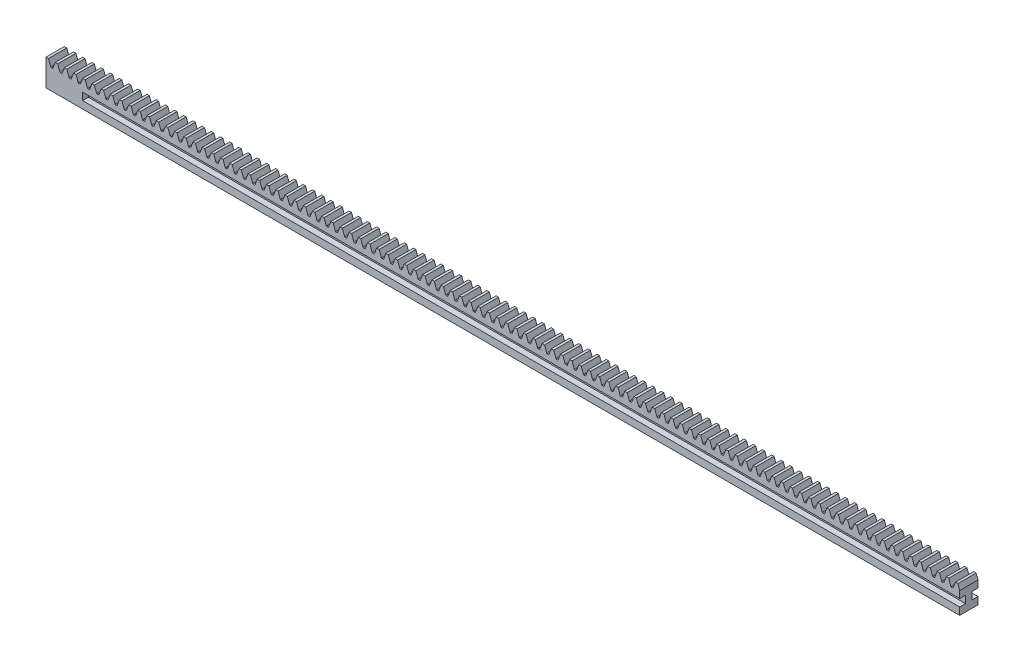
from build123d import *

# Parameters (mm, degrees)
BOSS_EXTRUDE1_DEPTH      = 125
BOSS_EXTRUDE1_DEPTH_BACK = 125
SKETCH3_W                = 5
SKETCH3_H                = 7.3
CUT_EXTRUDE1_DEPTH       = 126.078265498
FILLET1_R                = 0.167343945
LPATTERN1_START          = -2.5
LPATTERN1_DEPTH          = 5
SKETCH7_W                = 1.5875
SKETCH7_H                = 2
CUT_EXTRUDE2_DEPTH       = 240


# Read off the part's stored shape, not the designer's step: LPattern1
with BuildPart() as part:
    # Sketch3 → Boss-Extrude1 (new, two sides: drawn at the far end of the back side and taken through both)
    with BuildSketch(Plane(origin=(0, 0, 0), x_dir=(0, 0, -1), z_dir=(1, 0, 0)).offset(-BOSS_EXTRUDE1_DEPTH_BACK)):
        Rectangle(SKETCH3_W, SKETCH3_H)
    extrude(amount=BOSS_EXTRUDE1_DEPTH + BOSS_EXTRUDE1_DEPTH_BACK)

    # Sketch4 → Cut-Extrude1 (cut, symmetric)
    with BuildSketch(Plane.XY):
        Polygon((-124.325716375, 3.65), (-123.685128763, 1.89), (-123.127315612, 1.89), (-122.486728, 3.65), align=None)
    extrude(amount=CUT_EXTRUDE1_DEPTH, both=True, mode=Mode.SUBTRACT)

    # Fillet1
    fillet1_edges = [part.edges().sort_by_distance(p)[0] for p in [
        (-123.127315612, 1.89, 0),
        (-123.685128763, 1.89, 0),
    ]]
    fillet(fillet1_edges, radius=FILLET1_R)

    # LPattern1 outline → LPattern1 (cut)
    with BuildSketch(Plane.XY.offset(LPATTERN1_START)):
        with BuildLine():
            ThreePointArc((-121.211933141, 2.000108945), (-121.150665815, 1.92026381), (-121.054681271, 1.89))
            Line((-121.054681271, 1.89), (-120.731219104, 1.89))
            ThreePointArc((-120.731219104, 1.89), (-120.63523456, 1.92026381), (-120.573967234, 2.000108945))
            Line((-120.573967234, 2.000108945), (-119.973456, 3.65))
            Line((-119.973456, 3.65), (-121.812444375, 3.65))
            Line((-121.812444375, 3.65), (-121.211933141, 2.000108945))
        make_face()
        Polygon((125, 3.65), (124.488211625, 3.65), (125, 2.243872997), align=None)
        with BuildLine():
            Line((123.813928, 3.65), (121.974939625, 3.65))
            Line((121.974939625, 3.65), (122.575450859, 2.000108945))
            ThreePointArc((122.575450859, 2.000108945), (122.636718185, 1.92026381), (122.732702729, 1.89))
            Line((122.732702729, 1.89), (123.056164896, 1.89))
            ThreePointArc((123.056164896, 1.89), (123.15214944, 1.92026381), (123.213416766, 2.000108945))
            Line((123.213416766, 2.000108945), (123.813928, 3.65))
        make_face()
        with BuildLine():
            Line((121.300656, 3.65), (119.461667625, 3.65))
            Line((119.461667625, 3.65), (120.062178859, 2.000108945))
            ThreePointArc((120.062178859, 2.000108945), (120.123446185, 1.92026381), (120.219430729, 1.89))
            Line((120.219430729, 1.89), (120.542892896, 1.89))
            ThreePointArc((120.542892896, 1.89), (120.63887744, 1.92026381), (120.700144766, 2.000108945))
            Line((120.700144766, 2.000108945), (121.300656, 3.65))
        make_face()
        with BuildLine():
            Line((118.787384, 3.65), (116.948395625, 3.65))
            Line((116.948395625, 3.65), (117.548906859, 2.000108945))
            ThreePointArc((117.548906859, 2.000108945), (117.610174185, 1.92026381), (117.706158729, 1.89))
            Line((117.706158729, 1.89), (118.029620896, 1.89))
            ThreePointArc((118.029620896, 1.89), (118.12560544, 1.92026381), (118.186872766, 2.000108945))
            Line((118.186872766, 2.000108945), (118.787384, 3.65))
        make_face()
        with BuildLine():
            Line((116.274112, 3.65), (114.435123625, 3.65))
            Line((114.435123625, 3.65), (115.035634859, 2.000108945))
            ThreePointArc((115.035634859, 2.000108945), (115.096902185, 1.92026381), (115.192886729, 1.89))
            Line((115.192886729, 1.89), (115.516348896, 1.89))
            ThreePointArc((115.516348896, 1.89), (115.61233344, 1.92026381), (115.673600766, 2.000108945))
            Line((115.673600766, 2.000108945), (116.274112, 3.65))
        make_face()
        with BuildLine():
            Line((113.76084, 3.65), (111.921851625, 3.65))
            Line((111.921851625, 3.65), (112.522362859, 2.000108945))
            ThreePointArc((112.522362859, 2.000108945), (112.583630185, 1.92026381), (112.679614729, 1.89))
            Line((112.679614729, 1.89), (113.003076896, 1.89))
            ThreePointArc((113.003076896, 1.89), (113.09906144, 1.92026381), (113.160328766, 2.000108945))
            Line((113.160328766, 2.000108945), (113.76084, 3.65))
        make_face()
        with BuildLine():
            Line((111.247568, 3.65), (109.408579625, 3.65))
            Line((109.408579625, 3.65), (110.009090859, 2.000108945))
            ThreePointArc((110.009090859, 2.000108945), (110.070358185, 1.92026381), (110.166342729, 1.89))
            Line((110.166342729, 1.89), (110.489804896, 1.89))
            ThreePointArc((110.489804896, 1.89), (110.58578944, 1.92026381), (110.647056766, 2.000108945))
            Line((110.647056766, 2.000108945), (111.247568, 3.65))
        make_face()
        with BuildLine():
            Line((108.734296, 3.65), (106.895307625, 3.65))
            Line((106.895307625, 3.65), (107.495818859, 2.000108945))
            ThreePointArc((107.495818859, 2.000108945), (107.557086185, 1.92026381), (107.653070729, 1.89))
            Line((107.653070729, 1.89), (107.976532896, 1.89))
            ThreePointArc((107.976532896, 1.89), (108.07251744, 1.92026381), (108.133784766, 2.000108945))
            Line((108.133784766, 2.000108945), (108.734296, 3.65))
        make_face()
        with BuildLine():
            Line((106.221024, 3.65), (104.382035625, 3.65))
            Line((104.382035625, 3.65), (104.982546859, 2.000108945))
            ThreePointArc((104.982546859, 2.000108945), (105.043814185, 1.92026381), (105.139798729, 1.89))
            Line((105.139798729, 1.89), (105.463260896, 1.89))
            ThreePointArc((105.463260896, 1.89), (105.55924544, 1.92026381), (105.620512766, 2.000108945))
            Line((105.620512766, 2.000108945), (106.221024, 3.65))
        make_face()
        with BuildLine():
            Line((103.707752, 3.65), (101.868763625, 3.65))
            Line((101.868763625, 3.65), (102.469274859, 2.000108945))
            ThreePointArc((102.469274859, 2.000108945), (102.530542185, 1.92026381), (102.626526729, 1.89))
            Line((102.626526729, 1.89), (102.949988896, 1.89))
            ThreePointArc((102.949988896, 1.89), (103.04597344, 1.92026381), (103.107240766, 2.000108945))
            Line((103.107240766, 2.000108945), (103.707752, 3.65))
        make_face()
        with BuildLine():
            Line((101.19448, 3.65), (99.355491625, 3.65))
            Line((99.355491625, 3.65), (99.956002859, 2.000108945))
            ThreePointArc((99.956002859, 2.000108945), (100.017270185, 1.92026381), (100.113254729, 1.89))
            Line((100.113254729, 1.89), (100.436716896, 1.89))
            ThreePointArc((100.436716896, 1.89), (100.53270144, 1.92026381), (100.593968766, 2.000108945))
            Line((100.593968766, 2.000108945), (101.19448, 3.65))
        make_face()
        with BuildLine():
            Line((98.681208, 3.65), (96.842219625, 3.65))
            Line((96.842219625, 3.65), (97.442730859, 2.000108945))
            ThreePointArc((97.442730859, 2.000108945), (97.503998185, 1.92026381), (97.599982729, 1.89))
            Line((97.599982729, 1.89), (97.923444896, 1.89))
            ThreePointArc((97.923444896, 1.89), (98.01942944, 1.92026381), (98.080696766, 2.000108945))
            Line((98.080696766, 2.000108945), (98.681208, 3.65))
        make_face()
        with BuildLine():
            Line((96.167936, 3.65), (94.328947625, 3.65))
            Line((94.328947625, 3.65), (94.929458859, 2.000108945))
            ThreePointArc((94.929458859, 2.000108945), (94.990726185, 1.92026381), (95.086710729, 1.89))
            Line((95.086710729, 1.89), (95.410172896, 1.89))
            ThreePointArc((95.410172896, 1.89), (95.50615744, 1.92026381), (95.567424766, 2.000108945))
            Line((95.567424766, 2.000108945), (96.167936, 3.65))
        make_face()
        with BuildLine():
            Line((93.654664, 3.65), (91.815675625, 3.65))
            Line((91.815675625, 3.65), (92.416186859, 2.000108945))
            ThreePointArc((92.416186859, 2.000108945), (92.477454185, 1.92026381), (92.573438729, 1.89))
            Line((92.573438729, 1.89), (92.896900896, 1.89))
            ThreePointArc((92.896900896, 1.89), (92.99288544, 1.92026381), (93.054152766, 2.000108945))
            Line((93.054152766, 2.000108945), (93.654664, 3.65))
        make_face()
        with BuildLine():
            Line((91.141392, 3.65), (89.302403625, 3.65))
            Line((89.302403625, 3.65), (89.902914859, 2.000108945))
            ThreePointArc((89.902914859, 2.000108945), (89.964182185, 1.92026381), (90.060166729, 1.89))
            Line((90.060166729, 1.89), (90.383628896, 1.89))
            ThreePointArc((90.383628896, 1.89), (90.47961344, 1.92026381), (90.540880766, 2.000108945))
            Line((90.540880766, 2.000108945), (91.141392, 3.65))
        make_face()
        with BuildLine():
            Line((88.62812, 3.65), (86.789131625, 3.65))
            Line((86.789131625, 3.65), (87.389642859, 2.000108945))
            ThreePointArc((87.389642859, 2.000108945), (87.450910185, 1.92026381), (87.546894729, 1.89))
            Line((87.546894729, 1.89), (87.870356896, 1.89))
            ThreePointArc((87.870356896, 1.89), (87.96634144, 1.92026381), (88.027608766, 2.000108945))
            Line((88.027608766, 2.000108945), (88.62812, 3.65))
        make_face()
        with BuildLine():
            Line((86.114848, 3.65), (84.275859625, 3.65))
            Line((84.275859625, 3.65), (84.876370859, 2.000108945))
            ThreePointArc((84.876370859, 2.000108945), (84.937638185, 1.92026381), (85.033622729, 1.89))
            Line((85.033622729, 1.89), (85.357084896, 1.89))
            ThreePointArc((85.357084896, 1.89), (85.45306944, 1.92026381), (85.514336766, 2.000108945))
            Line((85.514336766, 2.000108945), (86.114848, 3.65))
        make_face()
        with BuildLine():
            Line((83.601576, 3.65), (81.762587625, 3.65))
            Line((81.762587625, 3.65), (82.363098859, 2.000108945))
            ThreePointArc((82.363098859, 2.000108945), (82.424366185, 1.92026381), (82.520350729, 1.89))
            Line((82.520350729, 1.89), (82.843812896, 1.89))
            ThreePointArc((82.843812896, 1.89), (82.93979744, 1.92026381), (83.001064766, 2.000108945))
            Line((83.001064766, 2.000108945), (83.601576, 3.65))
        make_face()
        with BuildLine():
            Line((81.088304, 3.65), (79.249315625, 3.65))
            Line((79.249315625, 3.65), (79.849826859, 2.000108945))
            ThreePointArc((79.849826859, 2.000108945), (79.911094185, 1.92026381), (80.007078729, 1.89))
            Line((80.007078729, 1.89), (80.330540896, 1.89))
            ThreePointArc((80.330540896, 1.89), (80.42652544, 1.92026381), (80.487792766, 2.000108945))
            Line((80.487792766, 2.000108945), (81.088304, 3.65))
        make_face()
        with BuildLine():
            Line((78.575032, 3.65), (76.736043625, 3.65))
            Line((76.736043625, 3.65), (77.336554859, 2.000108945))
            ThreePointArc((77.336554859, 2.000108945), (77.397822185, 1.92026381), (77.493806729, 1.89))
            Line((77.493806729, 1.89), (77.817268896, 1.89))
            ThreePointArc((77.817268896, 1.89), (77.91325344, 1.92026381), (77.974520766, 2.000108945))
            Line((77.974520766, 2.000108945), (78.575032, 3.65))
        make_face()
        with BuildLine():
            Line((76.06176, 3.65), (74.222771625, 3.65))
            Line((74.222771625, 3.65), (74.823282859, 2.000108945))
            ThreePointArc((74.823282859, 2.000108945), (74.884550185, 1.92026381), (74.980534729, 1.89))
            Line((74.980534729, 1.89), (75.303996896, 1.89))
            ThreePointArc((75.303996896, 1.89), (75.39998144, 1.92026381), (75.461248766, 2.000108945))
            Line((75.461248766, 2.000108945), (76.06176, 3.65))
        make_face()
        with BuildLine():
            Line((73.548488, 3.65), (71.709499625, 3.65))
            Line((71.709499625, 3.65), (72.310010859, 2.000108945))
            ThreePointArc((72.310010859, 2.000108945), (72.371278185, 1.92026381), (72.467262729, 1.89))
            Line((72.467262729, 1.89), (72.790724896, 1.89))
            ThreePointArc((72.790724896, 1.89), (72.88670944, 1.92026381), (72.947976766, 2.000108945))
            Line((72.947976766, 2.000108945), (73.548488, 3.65))
        make_face()
        with BuildLine():
            Line((71.035216, 3.65), (69.196227625, 3.65))
            Line((69.196227625, 3.65), (69.796738859, 2.000108945))
            ThreePointArc((69.796738859, 2.000108945), (69.858006185, 1.92026381), (69.953990729, 1.89))
            Line((69.953990729, 1.89), (70.277452896, 1.89))
            ThreePointArc((70.277452896, 1.89), (70.37343744, 1.92026381), (70.434704766, 2.000108945))
            Line((70.434704766, 2.000108945), (71.035216, 3.65))
        make_face()
        with BuildLine():
            Line((68.521944, 3.65), (66.682955625, 3.65))
            Line((66.682955625, 3.65), (67.283466859, 2.000108945))
            ThreePointArc((67.283466859, 2.000108945), (67.344734185, 1.92026381), (67.440718729, 1.89))
            Line((67.440718729, 1.89), (67.764180896, 1.89))
            ThreePointArc((67.764180896, 1.89), (67.86016544, 1.92026381), (67.921432766, 2.000108945))
            Line((67.921432766, 2.000108945), (68.521944, 3.65))
        make_face()
        with BuildLine():
            Line((66.008672, 3.65), (64.169683625, 3.65))
            Line((64.169683625, 3.65), (64.770194859, 2.000108945))
            ThreePointArc((64.770194859, 2.000108945), (64.831462185, 1.92026381), (64.927446729, 1.89))
            Line((64.927446729, 1.89), (65.250908896, 1.89))
            ThreePointArc((65.250908896, 1.89), (65.34689344, 1.92026381), (65.408160766, 2.000108945))
            Line((65.408160766, 2.000108945), (66.008672, 3.65))
        make_face()
        with BuildLine():
            Line((63.4954, 3.65), (61.656411625, 3.65))
            Line((61.656411625, 3.65), (62.256922859, 2.000108945))
            ThreePointArc((62.256922859, 2.000108945), (62.318190185, 1.92026381), (62.414174729, 1.89))
            Line((62.414174729, 1.89), (62.737636896, 1.89))
            ThreePointArc((62.737636896, 1.89), (62.83362144, 1.92026381), (62.894888766, 2.000108945))
            Line((62.894888766, 2.000108945), (63.4954, 3.65))
        make_face()
        with BuildLine():
            Line((60.982128, 3.65), (59.143139625, 3.65))
            Line((59.143139625, 3.65), (59.743650859, 2.000108945))
            ThreePointArc((59.743650859, 2.000108945), (59.804918185, 1.92026381), (59.900902729, 1.89))
            Line((59.900902729, 1.89), (60.224364896, 1.89))
            ThreePointArc((60.224364896, 1.89), (60.32034944, 1.92026381), (60.381616766, 2.000108945))
            Line((60.381616766, 2.000108945), (60.982128, 3.65))
        make_face()
        with BuildLine():
            Line((58.468856, 3.65), (56.629867625, 3.65))
            Line((56.629867625, 3.65), (57.230378859, 2.000108945))
            ThreePointArc((57.230378859, 2.000108945), (57.291646185, 1.92026381), (57.387630729, 1.89))
            Line((57.387630729, 1.89), (57.711092896, 1.89))
            ThreePointArc((57.711092896, 1.89), (57.80707744, 1.92026381), (57.868344766, 2.000108945))
            Line((57.868344766, 2.000108945), (58.468856, 3.65))
        make_face()
        with BuildLine():
            Line((55.955584, 3.65), (54.116595625, 3.65))
            Line((54.116595625, 3.65), (54.717106859, 2.000108945))
            ThreePointArc((54.717106859, 2.000108945), (54.778374185, 1.92026381), (54.874358729, 1.89))
            Line((54.874358729, 1.89), (55.197820896, 1.89))
            ThreePointArc((55.197820896, 1.89), (55.29380544, 1.92026381), (55.355072766, 2.000108945))
            Line((55.355072766, 2.000108945), (55.955584, 3.65))
        make_face()
        with BuildLine():
            Line((53.442312, 3.65), (51.603323625, 3.65))
            Line((51.603323625, 3.65), (52.203834859, 2.000108945))
            ThreePointArc((52.203834859, 2.000108945), (52.265102185, 1.92026381), (52.361086729, 1.89))
            Line((52.361086729, 1.89), (52.684548896, 1.89))
            ThreePointArc((52.684548896, 1.89), (52.78053344, 1.92026381), (52.841800766, 2.000108945))
            Line((52.841800766, 2.000108945), (53.442312, 3.65))
        make_face()
        with BuildLine():
            Line((50.92904, 3.65), (49.090051625, 3.65))
            Line((49.090051625, 3.65), (49.690562859, 2.000108945))
            ThreePointArc((49.690562859, 2.000108945), (49.751830185, 1.92026381), (49.847814729, 1.89))
            Line((49.847814729, 1.89), (50.171276896, 1.89))
            ThreePointArc((50.171276896, 1.89), (50.26726144, 1.92026381), (50.328528766, 2.000108945))
            Line((50.328528766, 2.000108945), (50.92904, 3.65))
        make_face()
        with BuildLine():
            Line((48.415768, 3.65), (46.576779625, 3.65))
            Line((46.576779625, 3.65), (47.177290859, 2.000108945))
            ThreePointArc((47.177290859, 2.000108945), (47.238558185, 1.92026381), (47.334542729, 1.89))
            Line((47.334542729, 1.89), (47.658004896, 1.89))
            ThreePointArc((47.658004896, 1.89), (47.75398944, 1.92026381), (47.815256766, 2.000108945))
            Line((47.815256766, 2.000108945), (48.415768, 3.65))
        make_face()
        with BuildLine():
            Line((45.902496, 3.65), (44.063507625, 3.65))
            Line((44.063507625, 3.65), (44.664018859, 2.000108945))
            ThreePointArc((44.664018859, 2.000108945), (44.725286185, 1.92026381), (44.821270729, 1.89))
            Line((44.821270729, 1.89), (45.144732896, 1.89))
            ThreePointArc((45.144732896, 1.89), (45.24071744, 1.92026381), (45.301984766, 2.000108945))
            Line((45.301984766, 2.000108945), (45.902496, 3.65))
        make_face()
        with BuildLine():
            Line((43.389224, 3.65), (41.550235625, 3.65))
            Line((41.550235625, 3.65), (42.150746859, 2.000108945))
            ThreePointArc((42.150746859, 2.000108945), (42.212014185, 1.92026381), (42.307998729, 1.89))
            Line((42.307998729, 1.89), (42.631460896, 1.89))
            ThreePointArc((42.631460896, 1.89), (42.72744544, 1.92026381), (42.788712766, 2.000108945))
            Line((42.788712766, 2.000108945), (43.389224, 3.65))
        make_face()
        with BuildLine():
            Line((40.875952, 3.65), (39.036963625, 3.65))
            Line((39.036963625, 3.65), (39.637474859, 2.000108945))
            ThreePointArc((39.637474859, 2.000108945), (39.698742185, 1.92026381), (39.794726729, 1.89))
            Line((39.794726729, 1.89), (40.118188896, 1.89))
            ThreePointArc((40.118188896, 1.89), (40.21417344, 1.92026381), (40.275440766, 2.000108945))
            Line((40.275440766, 2.000108945), (40.875952, 3.65))
        make_face()
        with BuildLine():
            Line((38.36268, 3.65), (36.523691625, 3.65))
            Line((36.523691625, 3.65), (37.124202859, 2.000108945))
            ThreePointArc((37.124202859, 2.000108945), (37.185470185, 1.92026381), (37.281454729, 1.89))
            Line((37.281454729, 1.89), (37.604916896, 1.89))
            ThreePointArc((37.604916896, 1.89), (37.70090144, 1.92026381), (37.762168766, 2.000108945))
            Line((37.762168766, 2.000108945), (38.36268, 3.65))
        make_face()
        with BuildLine():
            Line((35.849408, 3.65), (34.010419625, 3.65))
            Line((34.010419625, 3.65), (34.610930859, 2.000108945))
            ThreePointArc((34.610930859, 2.000108945), (34.672198185, 1.92026381), (34.768182729, 1.89))
            Line((34.768182729, 1.89), (35.091644896, 1.89))
            ThreePointArc((35.091644896, 1.89), (35.18762944, 1.92026381), (35.248896766, 2.000108945))
            Line((35.248896766, 2.000108945), (35.849408, 3.65))
        make_face()
        with BuildLine():
            Line((33.336136, 3.65), (31.497147625, 3.65))
            Line((31.497147625, 3.65), (32.097658859, 2.000108945))
            ThreePointArc((32.097658859, 2.000108945), (32.158926185, 1.92026381), (32.254910729, 1.89))
            Line((32.254910729, 1.89), (32.578372896, 1.89))
            ThreePointArc((32.578372896, 1.89), (32.67435744, 1.92026381), (32.735624766, 2.000108945))
            Line((32.735624766, 2.000108945), (33.336136, 3.65))
        make_face()
        with BuildLine():
            Line((30.822864, 3.65), (28.983875625, 3.65))
            Line((28.983875625, 3.65), (29.584386859, 2.000108945))
            ThreePointArc((29.584386859, 2.000108945), (29.645654185, 1.92026381), (29.741638729, 1.89))
            Line((29.741638729, 1.89), (30.065100896, 1.89))
            ThreePointArc((30.065100896, 1.89), (30.16108544, 1.92026381), (30.222352766, 2.000108945))
            Line((30.222352766, 2.000108945), (30.822864, 3.65))
        make_face()
        with BuildLine():
            Line((28.309592, 3.65), (26.470603625, 3.65))
            Line((26.470603625, 3.65), (27.071114859, 2.000108945))
            ThreePointArc((27.071114859, 2.000108945), (27.132382185, 1.92026381), (27.228366729, 1.89))
            Line((27.228366729, 1.89), (27.551828896, 1.89))
            ThreePointArc((27.551828896, 1.89), (27.64781344, 1.92026381), (27.709080766, 2.000108945))
            Line((27.709080766, 2.000108945), (28.309592, 3.65))
        make_face()
        with BuildLine():
            Line((25.79632, 3.65), (23.957331625, 3.65))
            Line((23.957331625, 3.65), (24.557842859, 2.000108945))
            ThreePointArc((24.557842859, 2.000108945), (24.619110185, 1.92026381), (24.715094729, 1.89))
            Line((24.715094729, 1.89), (25.038556896, 1.89))
            ThreePointArc((25.038556896, 1.89), (25.13454144, 1.92026381), (25.195808766, 2.000108945))
            Line((25.195808766, 2.000108945), (25.79632, 3.65))
        make_face()
        with BuildLine():
            Line((23.283048, 3.65), (21.444059625, 3.65))
            Line((21.444059625, 3.65), (22.044570859, 2.000108945))
            ThreePointArc((22.044570859, 2.000108945), (22.105838185, 1.92026381), (22.201822729, 1.89))
            Line((22.201822729, 1.89), (22.525284896, 1.89))
            ThreePointArc((22.525284896, 1.89), (22.62126944, 1.92026381), (22.682536766, 2.000108945))
            Line((22.682536766, 2.000108945), (23.283048, 3.65))
        make_face()
        with BuildLine():
            Line((20.769776, 3.65), (18.930787625, 3.65))
            Line((18.930787625, 3.65), (19.531298859, 2.000108945))
            ThreePointArc((19.531298859, 2.000108945), (19.592566185, 1.92026381), (19.688550729, 1.89))
            Line((19.688550729, 1.89), (20.012012896, 1.89))
            ThreePointArc((20.012012896, 1.89), (20.10799744, 1.92026381), (20.169264766, 2.000108945))
            Line((20.169264766, 2.000108945), (20.769776, 3.65))
        make_face()
        with BuildLine():
            Line((18.256504, 3.65), (16.417515625, 3.65))
            Line((16.417515625, 3.65), (17.018026859, 2.000108945))
            ThreePointArc((17.018026859, 2.000108945), (17.079294185, 1.92026381), (17.175278729, 1.89))
            Line((17.175278729, 1.89), (17.498740896, 1.89))
            ThreePointArc((17.498740896, 1.89), (17.59472544, 1.92026381), (17.655992766, 2.000108945))
            Line((17.655992766, 2.000108945), (18.256504, 3.65))
        make_face()
        with BuildLine():
            Line((15.743232, 3.65), (13.904243625, 3.65))
            Line((13.904243625, 3.65), (14.504754859, 2.000108945))
            ThreePointArc((14.504754859, 2.000108945), (14.566022185, 1.92026381), (14.662006729, 1.89))
            Line((14.662006729, 1.89), (14.985468896, 1.89))
            ThreePointArc((14.985468896, 1.89), (15.08145344, 1.92026381), (15.142720766, 2.000108945))
            Line((15.142720766, 2.000108945), (15.743232, 3.65))
        make_face()
        with BuildLine():
            Line((13.22996, 3.65), (11.390971625, 3.65))
            Line((11.390971625, 3.65), (11.991482859, 2.000108945))
            ThreePointArc((11.991482859, 2.000108945), (12.052750185, 1.92026381), (12.148734729, 1.89))
            Line((12.148734729, 1.89), (12.472196896, 1.89))
            ThreePointArc((12.472196896, 1.89), (12.56818144, 1.92026381), (12.629448766, 2.000108945))
            Line((12.629448766, 2.000108945), (13.22996, 3.65))
        make_face()
        with BuildLine():
            Line((10.716688, 3.65), (8.877699625, 3.65))
            Line((8.877699625, 3.65), (9.478210859, 2.000108945))
            ThreePointArc((9.478210859, 2.000108945), (9.539478185, 1.92026381), (9.635462729, 1.89))
            Line((9.635462729, 1.89), (9.958924896, 1.89))
            ThreePointArc((9.958924896, 1.89), (10.05490944, 1.92026381), (10.116176766, 2.000108945))
            Line((10.116176766, 2.000108945), (10.716688, 3.65))
        make_face()
        with BuildLine():
            Line((8.203416, 3.65), (6.364427625, 3.65))
            Line((6.364427625, 3.65), (6.964938859, 2.000108945))
            ThreePointArc((6.964938859, 2.000108945), (7.026206185, 1.92026381), (7.122190729, 1.89))
            Line((7.122190729, 1.89), (7.445652896, 1.89))
            ThreePointArc((7.445652896, 1.89), (7.54163744, 1.92026381), (7.602904766, 2.000108945))
            Line((7.602904766, 2.000108945), (8.203416, 3.65))
        make_face()
        with BuildLine():
            Line((5.690144, 3.65), (3.851155625, 3.65))
            Line((3.851155625, 3.65), (4.451666859, 2.000108945))
            ThreePointArc((4.451666859, 2.000108945), (4.512934185, 1.92026381), (4.608918729, 1.89))
            Line((4.608918729, 1.89), (4.932380896, 1.89))
            ThreePointArc((4.932380896, 1.89), (5.02836544, 1.92026381), (5.089632766, 2.000108945))
            Line((5.089632766, 2.000108945), (5.690144, 3.65))
        make_face()
        with BuildLine():
            Line((3.176872, 3.65), (1.337883625, 3.65))
            Line((1.337883625, 3.65), (1.938394859, 2.000108945))
            ThreePointArc((1.938394859, 2.000108945), (1.999662185, 1.92026381), (2.095646729, 1.89))
            Line((2.095646729, 1.89), (2.419108896, 1.89))
            ThreePointArc((2.419108896, 1.89), (2.51509344, 1.92026381), (2.576360766, 2.000108945))
            Line((2.576360766, 2.000108945), (3.176872, 3.65))
        make_face()
        with BuildLine():
            Line((0.6636, 3.65), (-1.175388375, 3.65))
            Line((-1.175388375, 3.65), (-0.574877141, 2.000108945))
            ThreePointArc((-0.574877141, 2.000108945), (-0.513609815, 1.92026381), (-0.417625271, 1.89))
            Line((-0.417625271, 1.89), (-0.094163104, 1.89))
            ThreePointArc((-0.094163104, 1.89), (0.00182144, 1.92026381), (0.063088766, 2.000108945))
            Line((0.063088766, 2.000108945), (0.6636, 3.65))
        make_face()
        with BuildLine():
            Line((-1.849672, 3.65), (-3.688660375, 3.65))
            Line((-3.688660375, 3.65), (-3.088149141, 2.000108945))
            ThreePointArc((-3.088149141, 2.000108945), (-3.026881815, 1.92026381), (-2.930897271, 1.89))
            Line((-2.930897271, 1.89), (-2.607435104, 1.89))
            ThreePointArc((-2.607435104, 1.89), (-2.51145056, 1.92026381), (-2.450183234, 2.000108945))
            Line((-2.450183234, 2.000108945), (-1.849672, 3.65))
        make_face()
        with BuildLine():
            Line((-4.362944, 3.65), (-6.201932375, 3.65))
            Line((-6.201932375, 3.65), (-5.601421141, 2.000108945))
            ThreePointArc((-5.601421141, 2.000108945), (-5.540153815, 1.92026381), (-5.444169271, 1.89))
            Line((-5.444169271, 1.89), (-5.120707104, 1.89))
            ThreePointArc((-5.120707104, 1.89), (-5.02472256, 1.92026381), (-4.963455234, 2.000108945))
            Line((-4.963455234, 2.000108945), (-4.362944, 3.65))
        make_face()
        with BuildLine():
            Line((-6.876216, 3.65), (-8.715204375, 3.65))
            Line((-8.715204375, 3.65), (-8.114693141, 2.000108945))
            ThreePointArc((-8.114693141, 2.000108945), (-8.053425815, 1.92026381), (-7.957441271, 1.89))
            Line((-7.957441271, 1.89), (-7.633979104, 1.89))
            ThreePointArc((-7.633979104, 1.89), (-7.53799456, 1.92026381), (-7.476727234, 2.000108945))
            Line((-7.476727234, 2.000108945), (-6.876216, 3.65))
        make_face()
        with BuildLine():
            Line((-9.389488, 3.65), (-11.228476375, 3.65))
            Line((-11.228476375, 3.65), (-10.627965141, 2.000108945))
            ThreePointArc((-10.627965141, 2.000108945), (-10.566697815, 1.92026381), (-10.470713271, 1.89))
            Line((-10.470713271, 1.89), (-10.147251104, 1.89))
            ThreePointArc((-10.147251104, 1.89), (-10.05126656, 1.92026381), (-9.989999234, 2.000108945))
            Line((-9.989999234, 2.000108945), (-9.389488, 3.65))
        make_face()
        with BuildLine():
            Line((-11.90276, 3.65), (-13.741748375, 3.65))
            Line((-13.741748375, 3.65), (-13.141237141, 2.000108945))
            ThreePointArc((-13.141237141, 2.000108945), (-13.079969815, 1.92026381), (-12.983985271, 1.89))
            Line((-12.983985271, 1.89), (-12.660523104, 1.89))
            ThreePointArc((-12.660523104, 1.89), (-12.56453856, 1.92026381), (-12.503271234, 2.000108945))
            Line((-12.503271234, 2.000108945), (-11.90276, 3.65))
        make_face()
        with BuildLine():
            Line((-14.416032, 3.65), (-16.255020375, 3.65))
            Line((-16.255020375, 3.65), (-15.654509141, 2.000108945))
            ThreePointArc((-15.654509141, 2.000108945), (-15.593241815, 1.92026381), (-15.497257271, 1.89))
            Line((-15.497257271, 1.89), (-15.173795104, 1.89))
            ThreePointArc((-15.173795104, 1.89), (-15.07781056, 1.92026381), (-15.016543234, 2.000108945))
            Line((-15.016543234, 2.000108945), (-14.416032, 3.65))
        make_face()
        with BuildLine():
            Line((-16.929304, 3.65), (-18.768292375, 3.65))
            Line((-18.768292375, 3.65), (-18.167781141, 2.000108945))
            ThreePointArc((-18.167781141, 2.000108945), (-18.106513815, 1.92026381), (-18.010529271, 1.89))
            Line((-18.010529271, 1.89), (-17.687067104, 1.89))
            ThreePointArc((-17.687067104, 1.89), (-17.59108256, 1.92026381), (-17.529815234, 2.000108945))
            Line((-17.529815234, 2.000108945), (-16.929304, 3.65))
        make_face()
        with BuildLine():
            Line((-19.442576, 3.65), (-21.281564375, 3.65))
            Line((-21.281564375, 3.65), (-20.681053141, 2.000108945))
            ThreePointArc((-20.681053141, 2.000108945), (-20.619785815, 1.92026381), (-20.523801271, 1.89))
            Line((-20.523801271, 1.89), (-20.200339104, 1.89))
            ThreePointArc((-20.200339104, 1.89), (-20.10435456, 1.92026381), (-20.043087234, 2.000108945))
            Line((-20.043087234, 2.000108945), (-19.442576, 3.65))
        make_face()
        with BuildLine():
            Line((-21.955848, 3.65), (-23.794836375, 3.65))
            Line((-23.794836375, 3.65), (-23.194325141, 2.000108945))
            ThreePointArc((-23.194325141, 2.000108945), (-23.133057815, 1.92026381), (-23.037073271, 1.89))
            Line((-23.037073271, 1.89), (-22.713611104, 1.89))
            ThreePointArc((-22.713611104, 1.89), (-22.61762656, 1.92026381), (-22.556359234, 2.000108945))
            Line((-22.556359234, 2.000108945), (-21.955848, 3.65))
        make_face()
        with BuildLine():
            Line((-24.46912, 3.65), (-26.308108375, 3.65))
            Line((-26.308108375, 3.65), (-25.707597141, 2.000108945))
            ThreePointArc((-25.707597141, 2.000108945), (-25.646329815, 1.92026381), (-25.550345271, 1.89))
            Line((-25.550345271, 1.89), (-25.226883104, 1.89))
            ThreePointArc((-25.226883104, 1.89), (-25.13089856, 1.92026381), (-25.069631234, 2.000108945))
            Line((-25.069631234, 2.000108945), (-24.46912, 3.65))
        make_face()
        with BuildLine():
            Line((-26.982392, 3.65), (-28.821380375, 3.65))
            Line((-28.821380375, 3.65), (-28.220869141, 2.000108945))
            ThreePointArc((-28.220869141, 2.000108945), (-28.159601815, 1.92026381), (-28.063617271, 1.89))
            Line((-28.063617271, 1.89), (-27.740155104, 1.89))
            ThreePointArc((-27.740155104, 1.89), (-27.64417056, 1.92026381), (-27.582903234, 2.000108945))
            Line((-27.582903234, 2.000108945), (-26.982392, 3.65))
        make_face()
        with BuildLine():
            Line((-29.495664, 3.65), (-31.334652375, 3.65))
            Line((-31.334652375, 3.65), (-30.734141141, 2.000108945))
            ThreePointArc((-30.734141141, 2.000108945), (-30.672873815, 1.92026381), (-30.576889271, 1.89))
            Line((-30.576889271, 1.89), (-30.253427104, 1.89))
            ThreePointArc((-30.253427104, 1.89), (-30.15744256, 1.92026381), (-30.096175234, 2.000108945))
            Line((-30.096175234, 2.000108945), (-29.495664, 3.65))
        make_face()
        with BuildLine():
            Line((-32.008936, 3.65), (-33.847924375, 3.65))
            Line((-33.847924375, 3.65), (-33.247413141, 2.000108945))
            ThreePointArc((-33.247413141, 2.000108945), (-33.186145815, 1.92026381), (-33.090161271, 1.89))
            Line((-33.090161271, 1.89), (-32.766699104, 1.89))
            ThreePointArc((-32.766699104, 1.89), (-32.67071456, 1.92026381), (-32.609447234, 2.000108945))
            Line((-32.609447234, 2.000108945), (-32.008936, 3.65))
        make_face()
        with BuildLine():
            Line((-34.522208, 3.65), (-36.361196375, 3.65))
            Line((-36.361196375, 3.65), (-35.760685141, 2.000108945))
            ThreePointArc((-35.760685141, 2.000108945), (-35.699417815, 1.92026381), (-35.603433271, 1.89))
            Line((-35.603433271, 1.89), (-35.279971104, 1.89))
            ThreePointArc((-35.279971104, 1.89), (-35.18398656, 1.92026381), (-35.122719234, 2.000108945))
            Line((-35.122719234, 2.000108945), (-34.522208, 3.65))
        make_face()
        with BuildLine():
            Line((-37.03548, 3.65), (-38.874468375, 3.65))
            Line((-38.874468375, 3.65), (-38.273957141, 2.000108945))
            ThreePointArc((-38.273957141, 2.000108945), (-38.212689815, 1.92026381), (-38.116705271, 1.89))
            Line((-38.116705271, 1.89), (-37.793243104, 1.89))
            ThreePointArc((-37.793243104, 1.89), (-37.69725856, 1.92026381), (-37.635991234, 2.000108945))
            Line((-37.635991234, 2.000108945), (-37.03548, 3.65))
        make_face()
        with BuildLine():
            Line((-39.548752, 3.65), (-41.387740375, 3.65))
            Line((-41.387740375, 3.65), (-40.787229141, 2.000108945))
            ThreePointArc((-40.787229141, 2.000108945), (-40.725961815, 1.92026381), (-40.629977271, 1.89))
            Line((-40.629977271, 1.89), (-40.306515104, 1.89))
            ThreePointArc((-40.306515104, 1.89), (-40.21053056, 1.92026381), (-40.149263234, 2.000108945))
            Line((-40.149263234, 2.000108945), (-39.548752, 3.65))
        make_face()
        with BuildLine():
            Line((-42.062024, 3.65), (-43.901012375, 3.65))
            Line((-43.901012375, 3.65), (-43.300501141, 2.000108945))
            ThreePointArc((-43.300501141, 2.000108945), (-43.239233815, 1.92026381), (-43.143249271, 1.89))
            Line((-43.143249271, 1.89), (-42.819787104, 1.89))
            ThreePointArc((-42.819787104, 1.89), (-42.72380256, 1.92026381), (-42.662535234, 2.000108945))
            Line((-42.662535234, 2.000108945), (-42.062024, 3.65))
        make_face()
        with BuildLine():
            Line((-44.575296, 3.65), (-46.414284375, 3.65))
            Line((-46.414284375, 3.65), (-45.813773141, 2.000108945))
            ThreePointArc((-45.813773141, 2.000108945), (-45.752505815, 1.92026381), (-45.656521271, 1.89))
            Line((-45.656521271, 1.89), (-45.333059104, 1.89))
            ThreePointArc((-45.333059104, 1.89), (-45.23707456, 1.92026381), (-45.175807234, 2.000108945))
            Line((-45.175807234, 2.000108945), (-44.575296, 3.65))
        make_face()
        with BuildLine():
            Line((-47.088568, 3.65), (-48.927556375, 3.65))
            Line((-48.927556375, 3.65), (-48.327045141, 2.000108945))
            ThreePointArc((-48.327045141, 2.000108945), (-48.265777815, 1.92026381), (-48.169793271, 1.89))
            Line((-48.169793271, 1.89), (-47.846331104, 1.89))
            ThreePointArc((-47.846331104, 1.89), (-47.75034656, 1.92026381), (-47.689079234, 2.000108945))
            Line((-47.689079234, 2.000108945), (-47.088568, 3.65))
        make_face()
        with BuildLine():
            Line((-49.60184, 3.65), (-51.440828375, 3.65))
            Line((-51.440828375, 3.65), (-50.840317141, 2.000108945))
            ThreePointArc((-50.840317141, 2.000108945), (-50.779049815, 1.92026381), (-50.683065271, 1.89))
            Line((-50.683065271, 1.89), (-50.359603104, 1.89))
            ThreePointArc((-50.359603104, 1.89), (-50.26361856, 1.92026381), (-50.202351234, 2.000108945))
            Line((-50.202351234, 2.000108945), (-49.60184, 3.65))
        make_face()
        with BuildLine():
            Line((-52.115112, 3.65), (-53.954100375, 3.65))
            Line((-53.954100375, 3.65), (-53.353589141, 2.000108945))
            ThreePointArc((-53.353589141, 2.000108945), (-53.292321815, 1.92026381), (-53.196337271, 1.89))
            Line((-53.196337271, 1.89), (-52.872875104, 1.89))
            ThreePointArc((-52.872875104, 1.89), (-52.77689056, 1.92026381), (-52.715623234, 2.000108945))
            Line((-52.715623234, 2.000108945), (-52.115112, 3.65))
        make_face()
        with BuildLine():
            Line((-54.628384, 3.65), (-56.467372375, 3.65))
            Line((-56.467372375, 3.65), (-55.866861141, 2.000108945))
            ThreePointArc((-55.866861141, 2.000108945), (-55.805593815, 1.92026381), (-55.709609271, 1.89))
            Line((-55.709609271, 1.89), (-55.386147104, 1.89))
            ThreePointArc((-55.386147104, 1.89), (-55.29016256, 1.92026381), (-55.228895234, 2.000108945))
            Line((-55.228895234, 2.000108945), (-54.628384, 3.65))
        make_face()
        with BuildLine():
            Line((-57.141656, 3.65), (-58.980644375, 3.65))
            Line((-58.980644375, 3.65), (-58.380133141, 2.000108945))
            ThreePointArc((-58.380133141, 2.000108945), (-58.318865815, 1.92026381), (-58.222881271, 1.89))
            Line((-58.222881271, 1.89), (-57.899419104, 1.89))
            ThreePointArc((-57.899419104, 1.89), (-57.80343456, 1.92026381), (-57.742167234, 2.000108945))
            Line((-57.742167234, 2.000108945), (-57.141656, 3.65))
        make_face()
        with BuildLine():
            Line((-59.654928, 3.65), (-61.493916375, 3.65))
            Line((-61.493916375, 3.65), (-60.893405141, 2.000108945))
            ThreePointArc((-60.893405141, 2.000108945), (-60.832137815, 1.92026381), (-60.736153271, 1.89))
            Line((-60.736153271, 1.89), (-60.412691104, 1.89))
            ThreePointArc((-60.412691104, 1.89), (-60.31670656, 1.92026381), (-60.255439234, 2.000108945))
            Line((-60.255439234, 2.000108945), (-59.654928, 3.65))
        make_face()
        with BuildLine():
            Line((-62.1682, 3.65), (-64.007188375, 3.65))
            Line((-64.007188375, 3.65), (-63.406677141, 2.000108945))
            ThreePointArc((-63.406677141, 2.000108945), (-63.345409815, 1.92026381), (-63.249425271, 1.89))
            Line((-63.249425271, 1.89), (-62.925963104, 1.89))
            ThreePointArc((-62.925963104, 1.89), (-62.82997856, 1.92026381), (-62.768711234, 2.000108945))
            Line((-62.768711234, 2.000108945), (-62.1682, 3.65))
        make_face()
        with BuildLine():
            Line((-64.681472, 3.65), (-66.520460375, 3.65))
            Line((-66.520460375, 3.65), (-65.919949141, 2.000108945))
            ThreePointArc((-65.919949141, 2.000108945), (-65.858681815, 1.92026381), (-65.762697271, 1.89))
            Line((-65.762697271, 1.89), (-65.439235104, 1.89))
            ThreePointArc((-65.439235104, 1.89), (-65.34325056, 1.92026381), (-65.281983234, 2.000108945))
            Line((-65.281983234, 2.000108945), (-64.681472, 3.65))
        make_face()
        with BuildLine():
            Line((-67.194744, 3.65), (-69.033732375, 3.65))
            Line((-69.033732375, 3.65), (-68.433221141, 2.000108945))
            ThreePointArc((-68.433221141, 2.000108945), (-68.371953815, 1.92026381), (-68.275969271, 1.89))
            Line((-68.275969271, 1.89), (-67.952507104, 1.89))
            ThreePointArc((-67.952507104, 1.89), (-67.85652256, 1.92026381), (-67.795255234, 2.000108945))
            Line((-67.795255234, 2.000108945), (-67.194744, 3.65))
        make_face()
        with BuildLine():
            Line((-69.708016, 3.65), (-71.547004375, 3.65))
            Line((-71.547004375, 3.65), (-70.946493141, 2.000108945))
            ThreePointArc((-70.946493141, 2.000108945), (-70.885225815, 1.92026381), (-70.789241271, 1.89))
            Line((-70.789241271, 1.89), (-70.465779104, 1.89))
            ThreePointArc((-70.465779104, 1.89), (-70.36979456, 1.92026381), (-70.308527234, 2.000108945))
            Line((-70.308527234, 2.000108945), (-69.708016, 3.65))
        make_face()
        with BuildLine():
            Line((-72.221288, 3.65), (-74.060276375, 3.65))
            Line((-74.060276375, 3.65), (-73.459765141, 2.000108945))
            ThreePointArc((-73.459765141, 2.000108945), (-73.398497815, 1.92026381), (-73.302513271, 1.89))
            Line((-73.302513271, 1.89), (-72.979051104, 1.89))
            ThreePointArc((-72.979051104, 1.89), (-72.88306656, 1.92026381), (-72.821799234, 2.000108945))
            Line((-72.821799234, 2.000108945), (-72.221288, 3.65))
        make_face()
        with BuildLine():
            Line((-74.73456, 3.65), (-76.573548375, 3.65))
            Line((-76.573548375, 3.65), (-75.973037141, 2.000108945))
            ThreePointArc((-75.973037141, 2.000108945), (-75.911769815, 1.92026381), (-75.815785271, 1.89))
            Line((-75.815785271, 1.89), (-75.492323104, 1.89))
            ThreePointArc((-75.492323104, 1.89), (-75.39633856, 1.92026381), (-75.335071234, 2.000108945))
            Line((-75.335071234, 2.000108945), (-74.73456, 3.65))
        make_face()
        with BuildLine():
            Line((-77.247832, 3.65), (-79.086820375, 3.65))
            Line((-79.086820375, 3.65), (-78.486309141, 2.000108945))
            ThreePointArc((-78.486309141, 2.000108945), (-78.425041815, 1.92026381), (-78.329057271, 1.89))
            Line((-78.329057271, 1.89), (-78.005595104, 1.89))
            ThreePointArc((-78.005595104, 1.89), (-77.90961056, 1.92026381), (-77.848343234, 2.000108945))
            Line((-77.848343234, 2.000108945), (-77.247832, 3.65))
        make_face()
        with BuildLine():
            Line((-79.761104, 3.65), (-81.600092375, 3.65))
            Line((-81.600092375, 3.65), (-80.999581141, 2.000108945))
            ThreePointArc((-80.999581141, 2.000108945), (-80.938313815, 1.92026381), (-80.842329271, 1.89))
            Line((-80.842329271, 1.89), (-80.518867104, 1.89))
            ThreePointArc((-80.518867104, 1.89), (-80.42288256, 1.92026381), (-80.361615234, 2.000108945))
            Line((-80.361615234, 2.000108945), (-79.761104, 3.65))
        make_face()
        with BuildLine():
            Line((-82.274376, 3.65), (-84.113364375, 3.65))
            Line((-84.113364375, 3.65), (-83.512853141, 2.000108945))
            ThreePointArc((-83.512853141, 2.000108945), (-83.451585815, 1.92026381), (-83.355601271, 1.89))
            Line((-83.355601271, 1.89), (-83.032139104, 1.89))
            ThreePointArc((-83.032139104, 1.89), (-82.93615456, 1.92026381), (-82.874887234, 2.000108945))
            Line((-82.874887234, 2.000108945), (-82.274376, 3.65))
        make_face()
        with BuildLine():
            Line((-84.787648, 3.65), (-86.626636375, 3.65))
            Line((-86.626636375, 3.65), (-86.026125141, 2.000108945))
            ThreePointArc((-86.026125141, 2.000108945), (-85.964857815, 1.92026381), (-85.868873271, 1.89))
            Line((-85.868873271, 1.89), (-85.545411104, 1.89))
            ThreePointArc((-85.545411104, 1.89), (-85.44942656, 1.92026381), (-85.388159234, 2.000108945))
            Line((-85.388159234, 2.000108945), (-84.787648, 3.65))
        make_face()
        with BuildLine():
            Line((-87.30092, 3.65), (-89.139908375, 3.65))
            Line((-89.139908375, 3.65), (-88.539397141, 2.000108945))
            ThreePointArc((-88.539397141, 2.000108945), (-88.478129815, 1.92026381), (-88.382145271, 1.89))
            Line((-88.382145271, 1.89), (-88.058683104, 1.89))
            ThreePointArc((-88.058683104, 1.89), (-87.96269856, 1.92026381), (-87.901431234, 2.000108945))
            Line((-87.901431234, 2.000108945), (-87.30092, 3.65))
        make_face()
        with BuildLine():
            Line((-89.814192, 3.65), (-91.653180375, 3.65))
            Line((-91.653180375, 3.65), (-91.052669141, 2.000108945))
            ThreePointArc((-91.052669141, 2.000108945), (-90.991401815, 1.92026381), (-90.895417271, 1.89))
            Line((-90.895417271, 1.89), (-90.571955104, 1.89))
            ThreePointArc((-90.571955104, 1.89), (-90.47597056, 1.92026381), (-90.414703234, 2.000108945))
            Line((-90.414703234, 2.000108945), (-89.814192, 3.65))
        make_face()
        with BuildLine():
            Line((-92.327464, 3.65), (-94.166452375, 3.65))
            Line((-94.166452375, 3.65), (-93.565941141, 2.000108945))
            ThreePointArc((-93.565941141, 2.000108945), (-93.504673815, 1.92026381), (-93.408689271, 1.89))
            Line((-93.408689271, 1.89), (-93.085227104, 1.89))
            ThreePointArc((-93.085227104, 1.89), (-92.98924256, 1.92026381), (-92.927975234, 2.000108945))
            Line((-92.927975234, 2.000108945), (-92.327464, 3.65))
        make_face()
        with BuildLine():
            Line((-94.840736, 3.65), (-96.679724375, 3.65))
            Line((-96.679724375, 3.65), (-96.079213141, 2.000108945))
            ThreePointArc((-96.079213141, 2.000108945), (-96.017945815, 1.92026381), (-95.921961271, 1.89))
            Line((-95.921961271, 1.89), (-95.598499104, 1.89))
            ThreePointArc((-95.598499104, 1.89), (-95.50251456, 1.92026381), (-95.441247234, 2.000108945))
            Line((-95.441247234, 2.000108945), (-94.840736, 3.65))
        make_face()
        with BuildLine():
            Line((-97.354008, 3.65), (-99.192996375, 3.65))
            Line((-99.192996375, 3.65), (-98.592485141, 2.000108945))
            ThreePointArc((-98.592485141, 2.000108945), (-98.531217815, 1.92026381), (-98.435233271, 1.89))
            Line((-98.435233271, 1.89), (-98.111771104, 1.89))
            ThreePointArc((-98.111771104, 1.89), (-98.01578656, 1.92026381), (-97.954519234, 2.000108945))
            Line((-97.954519234, 2.000108945), (-97.354008, 3.65))
        make_face()
        with BuildLine():
            Line((-99.86728, 3.65), (-101.706268375, 3.65))
            Line((-101.706268375, 3.65), (-101.105757141, 2.000108945))
            ThreePointArc((-101.105757141, 2.000108945), (-101.044489815, 1.92026381), (-100.948505271, 1.89))
            Line((-100.948505271, 1.89), (-100.625043104, 1.89))
            ThreePointArc((-100.625043104, 1.89), (-100.52905856, 1.92026381), (-100.467791234, 2.000108945))
            Line((-100.467791234, 2.000108945), (-99.86728, 3.65))
        make_face()
        with BuildLine():
            Line((-102.380552, 3.65), (-104.219540375, 3.65))
            Line((-104.219540375, 3.65), (-103.619029141, 2.000108945))
            ThreePointArc((-103.619029141, 2.000108945), (-103.557761815, 1.92026381), (-103.461777271, 1.89))
            Line((-103.461777271, 1.89), (-103.138315104, 1.89))
            ThreePointArc((-103.138315104, 1.89), (-103.04233056, 1.92026381), (-102.981063234, 2.000108945))
            Line((-102.981063234, 2.000108945), (-102.380552, 3.65))
        make_face()
        with BuildLine():
            Line((-104.893824, 3.65), (-106.732812375, 3.65))
            Line((-106.732812375, 3.65), (-106.132301141, 2.000108945))
            ThreePointArc((-106.132301141, 2.000108945), (-106.071033815, 1.92026381), (-105.975049271, 1.89))
            Line((-105.975049271, 1.89), (-105.651587104, 1.89))
            ThreePointArc((-105.651587104, 1.89), (-105.55560256, 1.92026381), (-105.494335234, 2.000108945))
            Line((-105.494335234, 2.000108945), (-104.893824, 3.65))
        make_face()
        with BuildLine():
            Line((-107.407096, 3.65), (-109.246084375, 3.65))
            Line((-109.246084375, 3.65), (-108.645573141, 2.000108945))
            ThreePointArc((-108.645573141, 2.000108945), (-108.584305815, 1.92026381), (-108.488321271, 1.89))
            Line((-108.488321271, 1.89), (-108.164859104, 1.89))
            ThreePointArc((-108.164859104, 1.89), (-108.06887456, 1.92026381), (-108.007607234, 2.000108945))
            Line((-108.007607234, 2.000108945), (-107.407096, 3.65))
        make_face()
        with BuildLine():
            Line((-109.920368, 3.65), (-111.759356375, 3.65))
            Line((-111.759356375, 3.65), (-111.158845141, 2.000108945))
            ThreePointArc((-111.158845141, 2.000108945), (-111.097577815, 1.92026381), (-111.001593271, 1.89))
            Line((-111.001593271, 1.89), (-110.678131104, 1.89))
            ThreePointArc((-110.678131104, 1.89), (-110.58214656, 1.92026381), (-110.520879234, 2.000108945))
            Line((-110.520879234, 2.000108945), (-109.920368, 3.65))
        make_face()
        with BuildLine():
            Line((-112.43364, 3.65), (-114.272628375, 3.65))
            Line((-114.272628375, 3.65), (-113.672117141, 2.000108945))
            ThreePointArc((-113.672117141, 2.000108945), (-113.610849815, 1.92026381), (-113.514865271, 1.89))
            Line((-113.514865271, 1.89), (-113.191403104, 1.89))
            ThreePointArc((-113.191403104, 1.89), (-113.09541856, 1.92026381), (-113.034151234, 2.000108945))
            Line((-113.034151234, 2.000108945), (-112.43364, 3.65))
        make_face()
        with BuildLine():
            Line((-114.946912, 3.65), (-116.785900375, 3.65))
            Line((-116.785900375, 3.65), (-116.185389141, 2.000108945))
            ThreePointArc((-116.185389141, 2.000108945), (-116.124121815, 1.92026381), (-116.028137271, 1.89))
            Line((-116.028137271, 1.89), (-115.704675104, 1.89))
            ThreePointArc((-115.704675104, 1.89), (-115.60869056, 1.92026381), (-115.547423234, 2.000108945))
            Line((-115.547423234, 2.000108945), (-114.946912, 3.65))
        make_face()
        with BuildLine():
            Line((-117.460184, 3.65), (-119.299172375, 3.65))
            Line((-119.299172375, 3.65), (-118.698661141, 2.000108945))
            ThreePointArc((-118.698661141, 2.000108945), (-118.637393815, 1.92026381), (-118.541409271, 1.89))
            Line((-118.541409271, 1.89), (-118.217947104, 1.89))
            ThreePointArc((-118.217947104, 1.89), (-118.12196256, 1.92026381), (-118.060695234, 2.000108945))
            Line((-118.060695234, 2.000108945), (-117.460184, 3.65))
        make_face()
    extrude(amount=LPATTERN1_DEPTH, mode=Mode.SUBTRACT)

    # Sketch7 → Cut-Extrude2 (cut)
    with BuildSketch(Plane(origin=(125, 0, 0), x_dir=(0, 0, -1), z_dir=(1, 0, 0))):
        with Locations((-1.70625, -0.65)):
            Rectangle(SKETCH7_W, SKETCH7_H)
        with Locations((1.70625, -0.65)):
            Rectangle(SKETCH7_W, SKETCH7_H)
    extrude(amount=-CUT_EXTRUDE2_DEPTH, mode=Mode.SUBTRACT)


solid = part.part
